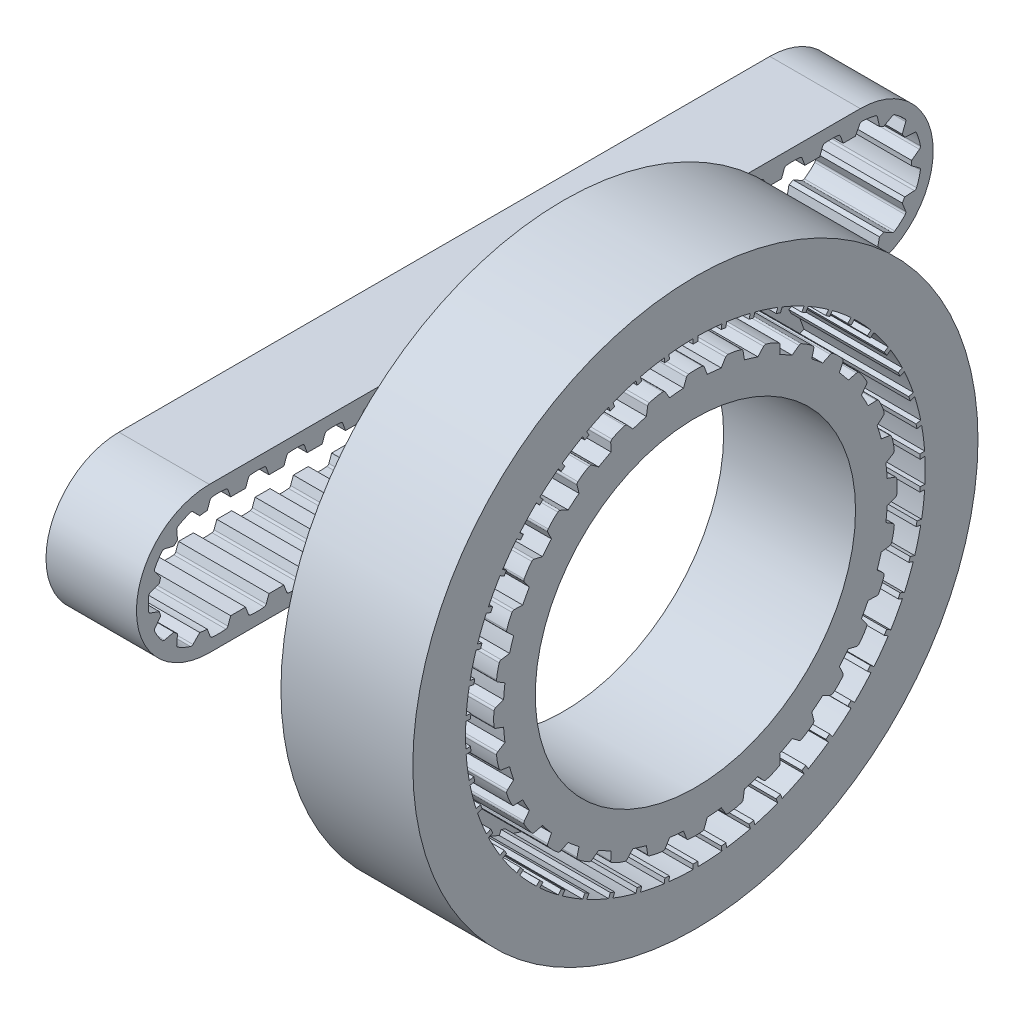
from build123d import *

# Parameters (mm, degrees)
SKETCH_2_W            = 4.8
SKETCH_2_H            = 1.14
CUT_EXTRUDE_1_DEPTH   = 39.690023029
PATTERN_START         = -2.4
PATTERN_CURVE_1_DEPTH = 4.8
SKETCH_10_R           = 15
EXTRUDE_3_DEPTH       = 7
SKETCH_11_R           = 12.2
SKETCH_11_R_2         = 10.2
CUT_EXTRUDE_3_DEPTH   = 5.8
EXTRUDE_START         = -5.8
EXTRUDE_4_DEPTH       = 5.8
PATTERN_CURVE_2_COUNT = 32
SKETCH_14_R           = 8.5
CUT_EXTRUDE_5_DEPTH   = 7
EXTRUDE_5_DEPTH       = 5.8
PATTERN_CURVE_3_COUNT = 50


# Read off the part's stored shape, not the designer's step: 曲线阵列1
with BuildPart() as part:
    # 扫描1: sweep along a path in 草图1
    with BuildLine(Plane(origin=(0, 0, 0), x_dir=(0, 0, -1), z_dir=(1, 0, 0))) as sweep_1_path:
        Line((0, 3.871), (34.55, 3.871))
        ThreePointArc((34.55, 3.871), (38.421, 0), (34.55, -3.871))
        Line((34.55, -3.871), (0, -3.871))
        ThreePointArc((0, -3.871), (-3.871, 0), (0, 3.871))
    # 草图2 → 扫描1 (sweep)
    with BuildSketch(Plane.XY):
        with Locations((0, 3.301)):
            Rectangle(SKETCH_2_W, SKETCH_2_H)
    sweep(path=sweep_1_path.line)

    # 草图3 → 切除-拉伸1 (cut, symmetric)
    with BuildSketch(Plane(origin=(0, 0, 0), x_dir=(0, 0, -1), z_dir=(1, 0, 0))):
        with BuildLine():
            Line((-3.135600662, 0.473139521), (-1.457, 1.084100197))
            Line((-1.457, 1.084100197), (-1.457, -1.084100197))
            Line((-1.457, -1.084100197), (-3.135600662, -0.473139521))
            ThreePointArc((-3.135600662, -0.473139521), (-3.193244809, -0.431441946), (-3.220308068, -0.365645932))
            ThreePointArc((-3.220308068, -0.365645932), (-3.241, 0), (-3.220308068, 0.365645932))
            ThreePointArc((-3.220308068, 0.365645932), (-3.193244809, 0.431441946), (-3.135600662, 0.473139521))
        make_face()
    extrude(amount=CUT_EXTRUDE_1_DEPTH, both=True, mode=Mode.SUBTRACT)

    # 曲线阵列1 outline → 曲线阵列1 (cut)
    with BuildSketch(Plane.YZ.offset(PATTERN_START)):
        with BuildLine():
            ThreePointArc((2.094145606, 2.381261577), (2.090258449, 2.452299774), (2.04956042, 2.510653916))
            ThreePointArc((2.04956042, 2.510653916), (1.75322603, 2.7258539), (1.434504949, 2.906247848))
            ThreePointArc((1.434504949, 2.906247848), (1.364527062, 2.919078701), (1.29827445, 2.893153292))
            Line((1.29827445, 2.893153292), (0.889306098, 2.582149427))
            ThreePointArc((0.889306098, 2.582149427), (1.477340416, 2.296916693), (1.980767104, 1.880139005))
            Line((1.980767104, 1.880139005), (2.094145606, 2.381261577))
        make_face()
        with BuildLine():
            Line((-2.094145606, 2.381261577), (-1.980767104, 1.880139005))
            ThreePointArc((-1.980767104, 1.880139005), (-1.477340416, 2.296916693), (-0.889306098, 2.582149427))
            Line((-0.889306098, 2.582149427), (-1.29827445, 2.893153292))
            ThreePointArc((-1.29827445, 2.893153292), (-1.364527062, 2.919078701), (-1.434504949, 2.906247848))
            ThreePointArc((-1.434504949, 2.906247848), (-1.75322603, 2.7258539), (-2.04956042, 2.510653916))
            ThreePointArc((-2.04956042, 2.510653916), (-2.090258449, 2.452299774), (-2.094145606, 2.381261577))
        make_face()
        with BuildLine():
            Line((-3.049436825, 0.869935381), (-2.682996107, 0.509796912))
            ThreePointArc((-2.682996107, 0.509796912), (-2.485044206, 1.132658949), (-2.144773245, 1.690653344))
            Line((-2.144773245, 1.690653344), (-2.656975666, 1.730991862))
            ThreePointArc((-2.656975666, 1.730991862), (-2.726722054, 1.716957019), (-2.778636312, 1.668310896))
            ThreePointArc((-2.778636312, 1.668310896), (-2.949113245, 1.344177098), (-3.081933373, 1.002879694))
            ThreePointArc((-3.081933373, 1.002879694), (-3.084595786, 0.93178506), (-3.049436825, 0.869935381))
        make_face()
        with BuildLine():
            Line((-3.135600662, -0.984740164), (-2.731, -1.132002762))
            Line((-2.731, -1.132002762), (-2.731, 0))
            ThreePointArc((-2.731, 0), (-2.730449894, 0.054812183), (-2.728799798, 0.109602284))
            Line((-2.728799798, 0.109602284), (-3.135600662, -0.038461122))
            ThreePointArc((-3.135600662, -0.038461122), (-3.193244809, -0.080158696), (-3.220308068, -0.14595471))
            ThreePointArc((-3.220308068, -0.14595471), (-3.241, -0.511600643), (-3.220308068, -0.877246575))
            ThreePointArc((-3.220308068, -0.877246575), (-3.193244809, -0.943042589), (-3.135600662, -0.984740164))
        make_face()
        with BuildLine():
            Line((-3.135600662, -3.016667359), (-2.731, -3.163929956))
            Line((-2.731, -3.163929956), (-2.731, -1.923125719))
            Line((-2.731, -1.923125719), (-3.135600662, -2.070388316))
            ThreePointArc((-3.135600662, -2.070388316), (-3.193244809, -2.112085891), (-3.220308068, -2.177881905))
            ThreePointArc((-3.220308068, -2.177881905), (-3.241, -2.543527838), (-3.220308068, -2.90917377))
            ThreePointArc((-3.220308068, -2.90917377), (-3.193244809, -2.974969784), (-3.135600662, -3.016667359))
        make_face()
        with BuildLine():
            Line((-3.135600662, -5.048594553), (-2.731, -5.195857151))
            Line((-2.731, -5.195857151), (-2.731, -3.955052913))
            Line((-2.731, -3.955052913), (-3.135600662, -4.102315511))
            ThreePointArc((-3.135600662, -4.102315511), (-3.193244809, -4.144013086), (-3.220308068, -4.2098091))
            ThreePointArc((-3.220308068, -4.2098091), (-3.241, -4.575455033), (-3.220308068, -4.941100965))
            ThreePointArc((-3.220308068, -4.941100965), (-3.193244809, -5.006896979), (-3.135600662, -5.048594553))
        make_face()
        with BuildLine():
            Line((-3.135600662, -7.080521748), (-2.731, -7.227784346))
            Line((-2.731, -7.227784346), (-2.731, -5.986980108))
            Line((-2.731, -5.986980108), (-3.135600662, -6.134242706))
            ThreePointArc((-3.135600662, -6.134242706), (-3.193244809, -6.175940281), (-3.220308068, -6.241736295))
            ThreePointArc((-3.220308068, -6.241736295), (-3.241, -6.607382228), (-3.220308068, -6.97302816))
            ThreePointArc((-3.220308068, -6.97302816), (-3.193244809, -7.038824174), (-3.135600662, -7.080521748))
        make_face()
        with BuildLine():
            Line((-3.135600662, -9.112448943), (-2.731, -9.259711541))
            Line((-2.731, -9.259711541), (-2.731, -8.018907303))
            Line((-2.731, -8.018907303), (-3.135600662, -8.166169901))
            ThreePointArc((-3.135600662, -8.166169901), (-3.193244809, -8.207867476), (-3.220308068, -8.27366349))
            ThreePointArc((-3.220308068, -8.27366349), (-3.241, -8.639309422), (-3.220308068, -9.004955354))
            ThreePointArc((-3.220308068, -9.004955354), (-3.193244809, -9.070751368), (-3.135600662, -9.112448943))
        make_face()
        with BuildLine():
            Line((-3.135600662, -11.144376138), (-2.731, -11.291638736))
            Line((-2.731, -11.291638736), (-2.731, -10.050834498))
            Line((-2.731, -10.050834498), (-3.135600662, -10.198097096))
            ThreePointArc((-3.135600662, -10.198097096), (-3.193244809, -10.23979467), (-3.220308068, -10.305590684))
            ThreePointArc((-3.220308068, -10.305590684), (-3.241, -10.671236616), (-3.220308068, -11.036882549))
            ThreePointArc((-3.220308068, -11.036882549), (-3.193244809, -11.102678563), (-3.135600662, -11.144376138))
        make_face()
        with BuildLine():
            Line((-3.135600662, -13.176303333), (-2.731, -13.323565931))
            Line((-2.731, -13.323565931), (-2.731, -12.082761693))
            Line((-2.731, -12.082761693), (-3.135600662, -12.230024291))
            ThreePointArc((-3.135600662, -12.230024291), (-3.193244809, -12.271721865), (-3.220308068, -12.337517879))
            ThreePointArc((-3.220308068, -12.337517879), (-3.241, -12.703163811), (-3.220308068, -13.068809744))
            ThreePointArc((-3.220308068, -13.068809744), (-3.193244809, -13.134605758), (-3.135600662, -13.176303333))
        make_face()
        with BuildLine():
            Line((-3.135600662, -15.208230528), (-2.731, -15.355493125))
            Line((-2.731, -15.355493125), (-2.731, -14.114688888))
            Line((-2.731, -14.114688888), (-3.135600662, -14.261951485))
            ThreePointArc((-3.135600662, -14.261951485), (-3.193244809, -14.30364906), (-3.220308068, -14.369445074))
            ThreePointArc((-3.220308068, -14.369445074), (-3.241, -14.735091006), (-3.220308068, -15.100736939))
            ThreePointArc((-3.220308068, -15.100736939), (-3.193244809, -15.166532953), (-3.135600662, -15.208230528))
        make_face()
        with BuildLine():
            Line((-3.135600662, -17.240157722), (-2.731, -17.38742032))
            Line((-2.731, -17.38742032), (-2.731, -16.146616082))
            Line((-2.731, -16.146616082), (-3.135600662, -16.29387868))
            ThreePointArc((-3.135600662, -16.29387868), (-3.193244809, -16.335576255), (-3.220308068, -16.401372269))
            ThreePointArc((-3.220308068, -16.401372269), (-3.241, -16.767018201), (-3.220308068, -17.132664134))
            ThreePointArc((-3.220308068, -17.132664134), (-3.193244809, -17.198460148), (-3.135600662, -17.240157722))
        make_face()
        with BuildLine():
            Line((-3.135600662, -19.272084917), (-2.731, -19.419347515))
            Line((-2.731, -19.419347515), (-2.731, -18.178543277))
            Line((-2.731, -18.178543277), (-3.135600662, -18.325805875))
            ThreePointArc((-3.135600662, -18.325805875), (-3.193244809, -18.36750345), (-3.220308068, -18.433299464))
            ThreePointArc((-3.220308068, -18.433299464), (-3.241, -18.798945396), (-3.220308068, -19.164591329))
            ThreePointArc((-3.220308068, -19.164591329), (-3.193244809, -19.230387342), (-3.135600662, -19.272084917))
        make_face()
        with BuildLine():
            Line((-3.135600662, -21.304012112), (-2.731, -21.45127471))
            Line((-2.731, -21.45127471), (-2.731, -20.210470472))
            Line((-2.731, -20.210470472), (-3.135600662, -20.35773307))
            ThreePointArc((-3.135600662, -20.35773307), (-3.193244809, -20.399430645), (-3.220308068, -20.465226658))
            ThreePointArc((-3.220308068, -20.465226658), (-3.241, -20.830872591), (-3.220308068, -21.196518523))
            ThreePointArc((-3.220308068, -21.196518523), (-3.193244809, -21.262314537), (-3.135600662, -21.304012112))
        make_face()
        with BuildLine():
            Line((-3.135600662, -23.335939307), (-2.731, -23.483201905))
            Line((-2.731, -23.483201905), (-2.731, -22.242397667))
            Line((-2.731, -22.242397667), (-3.135600662, -22.389660265))
            ThreePointArc((-3.135600662, -22.389660265), (-3.193244809, -22.431357839), (-3.220308068, -22.497153853))
            ThreePointArc((-3.220308068, -22.497153853), (-3.241, -22.862799786), (-3.220308068, -23.228445718))
            ThreePointArc((-3.220308068, -23.228445718), (-3.193244809, -23.294241732), (-3.135600662, -23.335939307))
        make_face()
        with BuildLine():
            Line((-3.135600662, -25.367866502), (-2.731, -25.515129099))
            Line((-2.731, -25.515129099), (-2.731, -24.274324862))
            Line((-2.731, -24.274324862), (-3.135600662, -24.421587459))
            ThreePointArc((-3.135600662, -24.421587459), (-3.193244809, -24.463285034), (-3.220308068, -24.529081048))
            ThreePointArc((-3.220308068, -24.529081048), (-3.241, -24.89472698), (-3.220308068, -25.260372913))
            ThreePointArc((-3.220308068, -25.260372913), (-3.193244809, -25.326168927), (-3.135600662, -25.367866502))
        make_face()
        with BuildLine():
            Line((-3.135600662, -27.399793696), (-2.731, -27.547056294))
            Line((-2.731, -27.547056294), (-2.731, -26.306252057))
            Line((-2.731, -26.306252057), (-3.135600662, -26.453514654))
            ThreePointArc((-3.135600662, -26.453514654), (-3.193244809, -26.495212229), (-3.220308068, -26.561008243))
            ThreePointArc((-3.220308068, -26.561008243), (-3.241, -26.926654175), (-3.220308068, -27.292300108))
            ThreePointArc((-3.220308068, -27.292300108), (-3.193244809, -27.358096122), (-3.135600662, -27.399793696))
        make_face()
        with BuildLine():
            Line((-3.135600662, -29.431720891), (-2.731, -29.578983489))
            Line((-2.731, -29.578983489), (-2.731, -28.338179251))
            Line((-2.731, -28.338179251), (-3.135600662, -28.485441849))
            ThreePointArc((-3.135600662, -28.485441849), (-3.193244809, -28.527139424), (-3.220308068, -28.592935438))
            ThreePointArc((-3.220308068, -28.592935438), (-3.241, -28.95858137), (-3.220308068, -29.324227303))
            ThreePointArc((-3.220308068, -29.324227303), (-3.193244809, -29.390023317), (-3.135600662, -29.431720891))
        make_face()
        with BuildLine():
            Line((-3.135600662, -31.463648086), (-2.731, -31.610910684))
            Line((-2.731, -31.610910684), (-2.731, -30.370106446))
            Line((-2.731, -30.370106446), (-3.135600662, -30.517369044))
            ThreePointArc((-3.135600662, -30.517369044), (-3.193244809, -30.559066619), (-3.220308068, -30.624862633))
            ThreePointArc((-3.220308068, -30.624862633), (-3.241, -30.990508565), (-3.220308068, -31.356154498))
            ThreePointArc((-3.220308068, -31.356154498), (-3.193244809, -31.421950511), (-3.135600662, -31.463648086))
        make_face()
        with BuildLine():
            Line((-3.135600662, -33.495575281), (-2.731, -33.642837879))
            Line((-2.731, -33.642837879), (-2.731, -32.402033641))
            Line((-2.731, -32.402033641), (-3.135600662, -32.549296239))
            ThreePointArc((-3.135600662, -32.549296239), (-3.193244809, -32.590993814), (-3.220308068, -32.656789827))
            ThreePointArc((-3.220308068, -32.656789827), (-3.241, -33.022435759), (-3.220308068, -33.388081692))
            ThreePointArc((-3.220308068, -33.388081692), (-3.193244809, -33.453877706), (-3.135600662, -33.495575281))
        make_face()
        with BuildLine():
            Line((-3.037195049, -35.461755862), (-2.534395304, -35.567448497))
            ThreePointArc((-2.534395304, -35.567448497), (-2.681398383, -35.06813484), (-2.731, -34.55))
            Line((-2.731, -34.55), (-2.731, -34.289763177))
            Line((-2.731, -34.289763177), (-3.170997751, -34.524984352))
            ThreePointArc((-3.170997751, -34.524984352), (-3.222166745, -34.574413791), (-3.239654615, -34.643375446))
            ThreePointArc((-3.239654615, -34.643375446), (-3.208436761, -35.008273445), (-3.136250838, -35.367319816))
            ThreePointArc((-3.136250838, -35.367319816), (-3.100156015, -35.428628047), (-3.037195049, -35.461755862))
        make_face()
        with BuildLine():
            Line((-2.061226739, -36.959812617), (-1.581170668, -36.776715141))
            ThreePointArc((-1.581170668, -36.776715141), (-2.064944793, -36.337278379), (-2.430459048, -35.795483768))
            Line((-2.430459048, -35.795483768), (-2.680510544, -36.244318666))
            ThreePointArc((-2.680510544, -36.244318666), (-2.696807434, -36.313571441), (-2.674210709, -36.381031973))
            ThreePointArc((-2.674210709, -36.381031973), (-2.450562458, -36.67104329), (-2.195623327, -36.93397131))
            ThreePointArc((-2.195623327, -36.93397131), (-2.132100834, -36.966009229), (-2.061226739, -36.959812617))
        make_face()
        with BuildLine():
            Line((-0.430008249, -37.691806077), (-0.125302464, -37.278123951))
            ThreePointArc((-0.125302464, -37.278123951), (-0.769896588, -37.170232861), (-1.370398554, -36.912280424))
            Line((-1.370398554, -36.912280424), (-1.337906983, -37.425040421))
            ThreePointArc((-1.337906983, -37.425040421), (-1.314151098, -37.492101538), (-1.258653123, -37.536615696))
            ThreePointArc((-1.258653123, -37.536615696), (-0.913670758, -37.659547675), (-0.557021862, -37.742774287))
            ThreePointArc((-0.557021862, -37.742774287), (-0.486265074, -37.735357255), (-0.430008249, -37.691806077))
        make_face()
        with BuildLine():
            Line((1.337906983, -37.425040421), (1.370398554, -36.912280424))
            ThreePointArc((1.370398554, -36.912280424), (0.769896588, -37.170232861), (0.125302464, -37.278123951))
            Line((0.125302464, -37.278123951), (0.430008249, -37.691806077))
            ThreePointArc((0.430008249, -37.691806077), (0.486265074, -37.735357255), (0.557021862, -37.742774287))
            ThreePointArc((0.557021862, -37.742774287), (0.913670758, -37.659547675), (1.258653123, -37.536615696))
            ThreePointArc((1.258653123, -37.536615696), (1.314151098, -37.492101538), (1.337906983, -37.425040421))
        make_face()
        with BuildLine():
            Line((2.680510544, -36.244318666), (2.430459048, -35.795483768))
            ThreePointArc((2.430459048, -35.795483768), (2.064944793, -36.337278379), (1.581170668, -36.776715141))
            Line((1.581170668, -36.776715141), (2.061226739, -36.959812617))
            ThreePointArc((2.061226739, -36.959812617), (2.132100834, -36.966009229), (2.195623327, -36.93397131))
            ThreePointArc((2.195623327, -36.93397131), (2.450562458, -36.67104329), (2.674210709, -36.381031973))
            ThreePointArc((2.674210709, -36.381031973), (2.696807434, -36.313571441), (2.680510544, -36.244318666))
        make_face()
        with BuildLine():
            Line((3.170997751, -34.524984352), (2.731, -34.289763177))
            Line((2.731, -34.289763177), (2.731, -34.55))
            ThreePointArc((2.731, -34.55), (2.681398383, -35.06813484), (2.534395304, -35.567448497))
            Line((2.534395304, -35.567448497), (3.037195049, -35.461755862))
            ThreePointArc((3.037195049, -35.461755862), (3.100156015, -35.428628047), (3.136250838, -35.367319816))
            ThreePointArc((3.136250838, -35.367319816), (3.208436761, -35.008273445), (3.239654615, -34.643375446))
            ThreePointArc((3.239654615, -34.643375446), (3.222166745, -34.574413791), (3.170997751, -34.524984352))
        make_face()
        with BuildLine():
            Line((3.135600662, -32.549296239), (2.731, -32.402033641))
            Line((2.731, -32.402033641), (2.731, -33.642837879))
            Line((2.731, -33.642837879), (3.135600662, -33.495575281))
            ThreePointArc((3.135600662, -33.495575281), (3.193244809, -33.453877706), (3.220308068, -33.388081692))
            ThreePointArc((3.220308068, -33.388081692), (3.241, -33.022435759), (3.220308068, -32.656789827))
            ThreePointArc((3.220308068, -32.656789827), (3.193244809, -32.590993814), (3.135600662, -32.549296239))
        make_face()
        with BuildLine():
            Line((3.135600662, -30.517369044), (2.731, -30.370106446))
            Line((2.731, -30.370106446), (2.731, -31.610910684))
            Line((2.731, -31.610910684), (3.135600662, -31.463648086))
            ThreePointArc((3.135600662, -31.463648086), (3.193244809, -31.421950511), (3.220308068, -31.356154498))
            ThreePointArc((3.220308068, -31.356154498), (3.241, -30.990508566), (3.220308068, -30.624862633))
            ThreePointArc((3.220308068, -30.624862633), (3.193244809, -30.559066619), (3.135600662, -30.517369044))
        make_face()
        with BuildLine():
            Line((3.135600662, -28.485441849), (2.731, -28.338179251))
            Line((2.731, -28.338179251), (2.731, -29.578983489))
            Line((2.731, -29.578983489), (3.135600662, -29.431720891))
            ThreePointArc((3.135600662, -29.431720891), (3.193244809, -29.390023317), (3.220308068, -29.324227303))
            ThreePointArc((3.220308068, -29.324227303), (3.241, -28.95858137), (3.220308068, -28.592935438))
            ThreePointArc((3.220308068, -28.592935438), (3.193244809, -28.527139424), (3.135600662, -28.485441849))
        make_face()
        with BuildLine():
            Line((3.135600662, -26.453514654), (2.731, -26.306252057))
            Line((2.731, -26.306252057), (2.731, -27.547056294))
            Line((2.731, -27.547056294), (3.135600662, -27.399793696))
            ThreePointArc((3.135600662, -27.399793696), (3.193244809, -27.358096122), (3.220308068, -27.292300108))
            ThreePointArc((3.220308068, -27.292300108), (3.241, -26.926654175), (3.220308068, -26.561008243))
            ThreePointArc((3.220308068, -26.561008243), (3.193244809, -26.495212229), (3.135600662, -26.453514654))
        make_face()
        with BuildLine():
            Line((3.135600662, -24.421587459), (2.731, -24.274324862))
            Line((2.731, -24.274324862), (2.731, -25.515129099))
            Line((2.731, -25.515129099), (3.135600662, -25.367866502))
            ThreePointArc((3.135600662, -25.367866502), (3.193244809, -25.326168927), (3.220308068, -25.260372913))
            ThreePointArc((3.220308068, -25.260372913), (3.241, -24.89472698), (3.220308068, -24.529081048))
            ThreePointArc((3.220308068, -24.529081048), (3.193244809, -24.463285034), (3.135600662, -24.421587459))
        make_face()
        with BuildLine():
            Line((3.135600662, -22.389660265), (2.731, -22.242397667))
            Line((2.731, -22.242397667), (2.731, -23.483201905))
            Line((2.731, -23.483201905), (3.135600662, -23.335939307))
            ThreePointArc((3.135600662, -23.335939307), (3.193244809, -23.294241732), (3.220308068, -23.228445718))
            ThreePointArc((3.220308068, -23.228445718), (3.241, -22.862799786), (3.220308068, -22.497153853))
            ThreePointArc((3.220308068, -22.497153853), (3.193244809, -22.431357839), (3.135600662, -22.389660265))
        make_face()
        with BuildLine():
            Line((3.135600662, -20.35773307), (2.731, -20.210470472))
            Line((2.731, -20.210470472), (2.731, -21.45127471))
            Line((2.731, -21.45127471), (3.135600662, -21.304012112))
            ThreePointArc((3.135600662, -21.304012112), (3.193244809, -21.262314537), (3.220308068, -21.196518523))
            ThreePointArc((3.220308068, -21.196518523), (3.241, -20.830872591), (3.220308068, -20.465226658))
            ThreePointArc((3.220308068, -20.465226658), (3.193244809, -20.399430645), (3.135600662, -20.35773307))
        make_face()
        with BuildLine():
            Line((3.135600662, -18.325805875), (2.731, -18.178543277))
            Line((2.731, -18.178543277), (2.731, -19.419347515))
            Line((2.731, -19.419347515), (3.135600662, -19.272084917))
            ThreePointArc((3.135600662, -19.272084917), (3.193244809, -19.230387342), (3.220308068, -19.164591329))
            ThreePointArc((3.220308068, -19.164591329), (3.241, -18.798945397), (3.220308068, -18.433299464))
            ThreePointArc((3.220308068, -18.433299464), (3.193244809, -18.36750345), (3.135600662, -18.325805875))
        make_face()
        with BuildLine():
            Line((3.135600662, -16.29387868), (2.731, -16.146616082))
            Line((2.731, -16.146616082), (2.731, -17.38742032))
            Line((2.731, -17.38742032), (3.135600662, -17.240157722))
            ThreePointArc((3.135600662, -17.240157722), (3.193244809, -17.198460148), (3.220308068, -17.132664134))
            ThreePointArc((3.220308068, -17.132664134), (3.241, -16.767018202), (3.220308068, -16.401372269))
            ThreePointArc((3.220308068, -16.401372269), (3.193244809, -16.335576255), (3.135600662, -16.29387868))
        make_face()
        with BuildLine():
            Line((3.135600662, -14.261951485), (2.731, -14.114688888))
            Line((2.731, -14.114688888), (2.731, -15.355493125))
            Line((2.731, -15.355493125), (3.135600662, -15.208230528))
            ThreePointArc((3.135600662, -15.208230528), (3.193244809, -15.166532953), (3.220308068, -15.100736939))
            ThreePointArc((3.220308068, -15.100736939), (3.241, -14.735091006), (3.220308068, -14.369445074))
            ThreePointArc((3.220308068, -14.369445074), (3.193244809, -14.30364906), (3.135600662, -14.261951485))
        make_face()
        with BuildLine():
            Line((3.135600662, -12.230024291), (2.731, -12.082761693))
            Line((2.731, -12.082761693), (2.731, -13.323565931))
            Line((2.731, -13.323565931), (3.135600662, -13.176303333))
            ThreePointArc((3.135600662, -13.176303333), (3.193244809, -13.134605758), (3.220308068, -13.068809744))
            ThreePointArc((3.220308068, -13.068809744), (3.241, -12.703163811), (3.220308068, -12.337517879))
            ThreePointArc((3.220308068, -12.337517879), (3.193244809, -12.271721865), (3.135600662, -12.230024291))
        make_face()
        with BuildLine():
            Line((3.135600662, -10.198097096), (2.731, -10.050834498))
            Line((2.731, -10.050834498), (2.731, -11.291638736))
            Line((2.731, -11.291638736), (3.135600662, -11.144376138))
            ThreePointArc((3.135600662, -11.144376138), (3.193244809, -11.102678563), (3.220308068, -11.036882549))
            ThreePointArc((3.220308068, -11.036882549), (3.241, -10.671236616), (3.220308068, -10.305590684))
            ThreePointArc((3.220308068, -10.305590684), (3.193244809, -10.23979467), (3.135600662, -10.198097096))
        make_face()
        with BuildLine():
            Line((3.135600662, -8.166169901), (2.731, -8.018907303))
            Line((2.731, -8.018907303), (2.731, -9.259711541))
            Line((2.731, -9.259711541), (3.135600662, -9.112448943))
            ThreePointArc((3.135600662, -9.112448943), (3.193244809, -9.070751368), (3.220308068, -9.004955354))
            ThreePointArc((3.220308068, -9.004955354), (3.241, -8.639309422), (3.220308068, -8.27366349))
            ThreePointArc((3.220308068, -8.27366349), (3.193244809, -8.207867476), (3.135600662, -8.166169901))
        make_face()
        with BuildLine():
            Line((3.135600662, -6.134242706), (2.731, -5.986980108))
            Line((2.731, -5.986980108), (2.731, -7.227784346))
            Line((2.731, -7.227784346), (3.135600662, -7.080521748))
            ThreePointArc((3.135600662, -7.080521748), (3.193244809, -7.038824174), (3.220308068, -6.97302816))
            ThreePointArc((3.220308068, -6.97302816), (3.241, -6.607382228), (3.220308068, -6.241736295))
            ThreePointArc((3.220308068, -6.241736295), (3.193244809, -6.175940281), (3.135600662, -6.134242706))
        make_face()
        with BuildLine():
            Line((3.135600662, -4.102315511), (2.731, -3.955052913))
            Line((2.731, -3.955052913), (2.731, -5.195857151))
            Line((2.731, -5.195857151), (3.135600662, -5.048594553))
            ThreePointArc((3.135600662, -5.048594553), (3.193244809, -5.006896979), (3.220308068, -4.941100965))
            ThreePointArc((3.220308068, -4.941100965), (3.241, -4.575455032), (3.220308068, -4.2098091))
            ThreePointArc((3.220308068, -4.2098091), (3.193244809, -4.144013086), (3.135600662, -4.102315511))
        make_face()
        with BuildLine():
            Line((3.135600662, -2.070388316), (2.731, -1.923125719))
            Line((2.731, -1.923125719), (2.731, -3.163929956))
            Line((2.731, -3.163929956), (3.135600662, -3.016667359))
            ThreePointArc((3.135600662, -3.016667359), (3.193244809, -2.974969784), (3.220308068, -2.90917377))
            ThreePointArc((3.220308068, -2.90917377), (3.241, -2.543527838), (3.220308068, -2.177881905))
            ThreePointArc((3.220308068, -2.177881905), (3.193244809, -2.112085891), (3.135600662, -2.070388316))
        make_face()
        with BuildLine():
            Line((3.135600662, -0.038461122), (2.728799798, 0.109602284))
            ThreePointArc((2.728799798, 0.109602284), (2.730449894, 0.054812183), (2.731, 0))
            Line((2.731, 0), (2.731, -1.132002762))
            Line((2.731, -1.132002762), (3.135600662, -0.984740164))
            ThreePointArc((3.135600662, -0.984740164), (3.193244809, -0.943042589), (3.220308068, -0.877246575))
            ThreePointArc((3.220308068, -0.877246575), (3.241, -0.511600642), (3.220308068, -0.14595471))
            ThreePointArc((3.220308068, -0.14595471), (3.193244809, -0.080158696), (3.135600662, -0.038461122))
        make_face()
        with BuildLine():
            Line((2.656975666, 1.730991862), (2.144773245, 1.690653344))
            ThreePointArc((2.144773245, 1.690653344), (2.485044206, 1.132658949), (2.682996107, 0.509796912))
            Line((2.682996107, 0.509796912), (3.049436825, 0.869935381))
            ThreePointArc((3.049436825, 0.869935381), (3.084595786, 0.93178506), (3.081933373, 1.002879694))
            ThreePointArc((3.081933373, 1.002879694), (2.949113245, 1.344177098), (2.778636312, 1.668310896))
            ThreePointArc((2.778636312, 1.668310896), (2.726722054, 1.716957019), (2.656975666, 1.730991862))
        make_face()
    extrude(amount=PATTERN_CURVE_1_DEPTH, mode=Mode.SUBTRACT)

    # 草图10 → 凸台-拉伸3 (add)
    with BuildSketch(Plane(origin=(2.4, 0, 0), x_dir=(0, 0, -1), z_dir=(1, 0, 0))):
        with Locations(Location((18.798945396, -7.469, 0), (0, 0, 166.121328942))):
            Circle(SKETCH_10_R)
    extrude(amount=EXTRUDE_3_DEPTH)

    # 草图11 → 切除-拉伸3 (cut)
    with BuildSketch(Plane(origin=(9.4, 0, 0), x_dir=(0, 0, -1), z_dir=(1, 0, 0))):
        with Locations((18.798945396, -7.469)):
            Circle(SKETCH_11_R)
        with Locations((18.798945396, -7.469)):
            Circle(SKETCH_11_R_2, mode=Mode.SUBTRACT)
    extrude(amount=-CUT_EXTRUDE_3_DEPTH, mode=Mode.SUBTRACT)

    # 草图12 → 凸台-拉伸4 (add)
    with BuildSketch(Plane(origin=(9.4, 0, 0), x_dir=(0, 0, -1), z_dir=(1, 0, 0)).offset(EXTRUDE_START)):
        with BuildLine():
            Line((18.325805875, 3.135600662), (18.171512859, 2.711684084))
            ThreePointArc((18.171512859, 2.711684084), (18.798945396, 2.731), (19.426377934, 2.711684084))
            Line((19.426377934, 2.711684084), (19.272084917, 3.135600662))
            ThreePointArc((19.272084917, 3.135600662), (19.230387342, 3.193244809), (19.164591329, 3.220308068))
            ThreePointArc((19.164591329, 3.220308068), (18.798945396, 3.241), (18.433299464, 3.220308068))
            ThreePointArc((18.433299464, 3.220308068), (18.36750345, 3.193244809), (18.325805875, 3.135600662))
        make_face()
    extrude_4 = extrude(amount=EXTRUDE_4_DEPTH)

    # 曲线阵列2: 凸台-拉伸4 ×32 about axis
    pattern_curve_2_axis = Axis((9.4, -7.469, -18.798945396), (1, 0, 0))
    for i in range(1, PATTERN_CURVE_2_COUNT):
        add(extrude_4.rotate(pattern_curve_2_axis, i * 360 / PATTERN_CURVE_2_COUNT))

    # 草图14 → 切除-拉伸5 (cut)
    with BuildSketch(Plane(origin=(9.4, 0, 0), x_dir=(0, 0, -1), z_dir=(1, 0, 0))):
        with Locations((18.798945396, -7.469)):
            Circle(SKETCH_14_R)
    extrude(amount=-CUT_EXTRUDE_5_DEPTH, mode=Mode.SUBTRACT)


with BuildPart() as body_2:
    # Split Bodies 1: the piece on the far side of the plane
    add(part.part)
    split(bisect_by=Plane(origin=(2.4, 0, 0), x_dir=(0, 0, 1), z_dir=(1, 0, 0)), keep=Keep.BOTTOM)


with BuildPart() as part_1:
    add(part.part)

    # Split Bodies 1
    split(bisect_by=Plane(origin=(2.4, 0, 0), x_dir=(0, 0, 1), z_dir=(1, 0, 0)), keep=Keep.TOP)

    # 草图16 → 凸台-拉伸5 (add)
    with BuildSketch(Plane(origin=(9.4, 0, 0), x_dir=(0, 0, -1), z_dir=(1, 0, 0))):
        with BuildLine():
            Line((18.673945396, 4.730359614), (18.673945396, 4.480359614))
            Line((18.673945396, 4.480359614), (18.923945396, 4.480359614))
            Line((18.923945396, 4.480359614), (18.923945396, 4.730359614))
            ThreePointArc((18.923945396, 4.730359614), (18.798945396, 4.731), (18.673945396, 4.730359614))
        make_face()
    extrude_5 = extrude(amount=-EXTRUDE_5_DEPTH)

    # 曲线阵列3: 凸台-拉伸5 ×50 about axis
    pattern_curve_3_axis = Axis((9.4, -7.469, -18.798945396), (1, 0, 0))
    for i in range(1, PATTERN_CURVE_3_COUNT):
        add(extrude_5.rotate(pattern_curve_3_axis, i * 360 / PATTERN_CURVE_3_COUNT))


solid = Compound([body_2.part, part_1.part])
